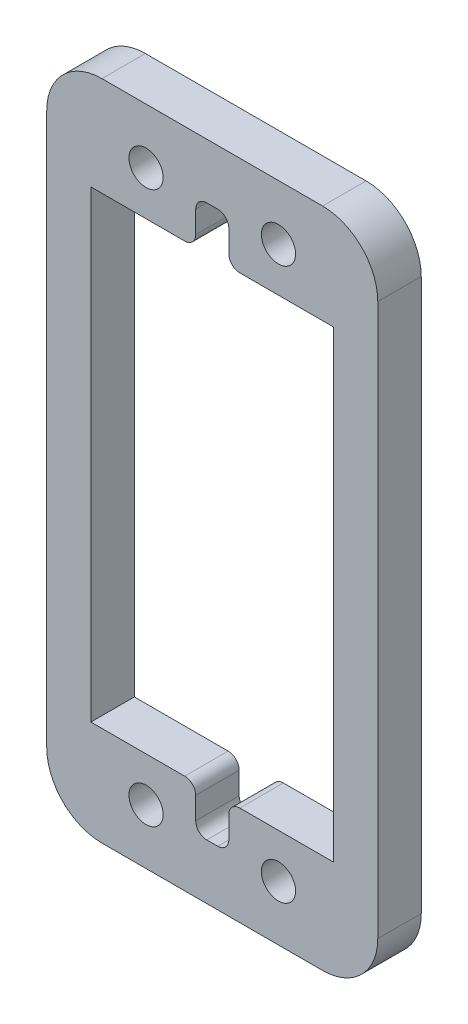
from build123d import *

# Parameters (mm, degrees)
CROQUIS1_W              = 30
CROQUIS1_H              = 60
SALIENTE_EXTRUIR1_DEPTH = 3.94
CROQUIS2_W              = 22
CROQUIS2_H              = 42
CORTAR_EXTRUIR1_DEPTH   = 34.771638989
CROQUIS3_R              = 1.55
CORTAR_EXTRUIR2_DEPTH   = 34.771638989
REDONDEO1_R             = 5
REDONDEO3_R             = 1


with BuildPart() as part:
    # Croquis1 → Saliente-Extruir1 (new body)
    with BuildSketch(Plane.XY):
        Rectangle(CROQUIS1_W, CROQUIS1_H)
    extrude(amount=SALIENTE_EXTRUIR1_DEPTH)

    # Croquis2 → Cortar-Extruir1 (cut, through all)
    with BuildSketch(Plane(origin=(0, 0, 0), x_dir=(-1, 0, 0), z_dir=(0, 0, -1))):
        Rectangle(CROQUIS2_W, CROQUIS2_H)
    extrude(amount=-CORTAR_EXTRUIR1_DEPTH, mode=Mode.SUBTRACT)

    # Croquis3 → Cortar-Extruir2 (cut, through all)
    with BuildSketch(Plane(origin=(0, 0, 0), x_dir=(-1, 0, 0), z_dir=(0, 0, -1))):
        with Locations((-6, 25)):
            Circle(CROQUIS3_R)
        with Locations((6, 25)):
            Circle(CROQUIS3_R)
        with Locations((-6, -25)):
            Circle(CROQUIS3_R)
        with Locations((6, -25)):
            Circle(CROQUIS3_R)
        Polygon((-1.5, 21), (-1.5, 25), (1.5, 25), (1.5, -25), (-1.5, -25), align=None)
    extrude(amount=-CORTAR_EXTRUIR2_DEPTH, mode=Mode.SUBTRACT)

    # Redondeo1
    redondeo1_edges = [part.edges().sort_by_distance(p)[0] for p in [
        (-15, -30, 1.97),
        (15, -30, 1.97),
        (15, 30, 1.97),
        (-15, 30, 1.97),
    ]]
    fillet(redondeo1_edges, radius=REDONDEO1_R)

    # Redondeo3
    redondeo3_edges = [part.edges().sort_by_distance(p)[0] for p in [
        (-1.5, -25, 1.97),
        (-1.5, -21, 1.97),
        (1.5, -21, 1.97),
        (1.5, -25, 1.97),
        (1.5, 25, 1.97),
        (-1.5, 25, 1.97),
        (1.5, 21, 1.97),
        (-1.5, 21, 1.97),
    ]]
    fillet(redondeo3_edges, radius=REDONDEO3_R)


solid = part.part
